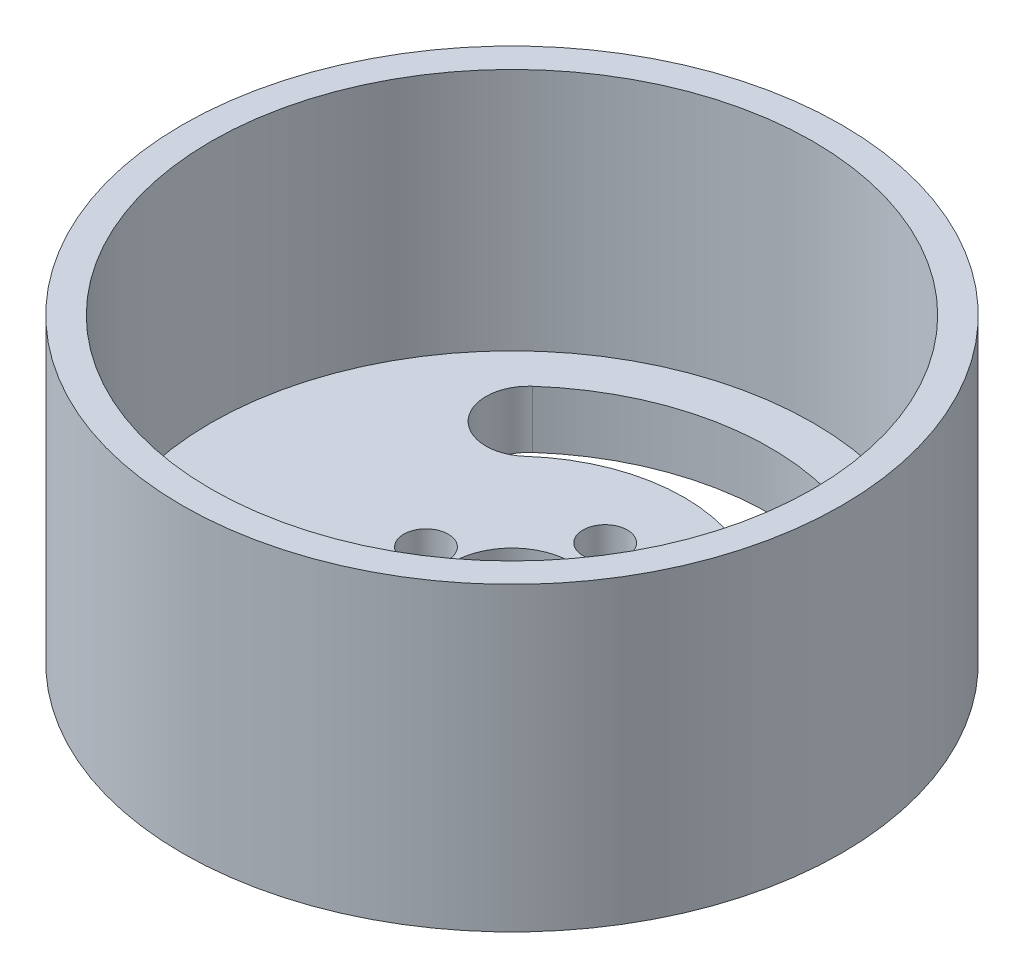
from build123d import *

# Parameters (mm, degrees)
SKETCH_1_R      = 23
SKETCH_1_R_2    = 21
EXTRUDE_1_DEPTH = 21
SKETCH_2_R      = 23
SKETCH_2_R_2    = 4.15
SKETCH_2_R_3    = 1.55
EXTRUDE_2_DEPTH = 4


with BuildPart() as part:
    # 草图1 → 凸台-拉伸1 (new body)
    with BuildSketch(Plane(origin=(0, 0, 0), x_dir=(1, 0, 0), z_dir=(0, 1, 0))):
        Circle(SKETCH_1_R)
        Circle(SKETCH_1_R_2, mode=Mode.SUBTRACT)
    extrude(amount=EXTRUDE_1_DEPTH)

    # 草图2 → 凸台-拉伸2 (add)
    with BuildSketch(Plane.XZ):
        Circle(SKETCH_2_R)
        Circle(SKETCH_2_R_2, mode=Mode.SUBTRACT)
        with Locations((6, 0)):
            Circle(SKETCH_2_R_3, mode=Mode.SUBTRACT)
        with Locations((-6, 0)):
            Circle(SKETCH_2_R_3, mode=Mode.SUBTRACT)
        with Locations((0, 6.5)):
            Circle(SKETCH_2_R_3, mode=Mode.SUBTRACT)
        with Locations((0, -6.5)):
            Circle(SKETCH_2_R_3, mode=Mode.SUBTRACT)
        with BuildLine():
            ThreePointArc((12, 13.416407865), (0, 18), (-12, 13.416407865))
            ThreePointArc((-12, 13.416407865), (-12.236067977, 9.180339887), (-8, 8.94427191))
            ThreePointArc((-8, 8.94427191), (0, 12), (8, 8.94427191))
            ThreePointArc((8, 8.94427191), (12.236067977, 9.180339887), (12, 13.416407865))
        make_face(mode=Mode.SUBTRACT)
        with BuildLine():
            ThreePointArc((12, -13.416407865), (0, -18), (-12, -13.416407865))
            ThreePointArc((-12, -13.416407865), (-12.236067977, -9.180339887), (-8, -8.94427191))
            ThreePointArc((-8, -8.94427191), (0, -12), (8, -8.94427191))
            ThreePointArc((8, -8.94427191), (12.236067977, -9.180339887), (12, -13.416407865))
        make_face(mode=Mode.SUBTRACT)
    extrude(amount=-EXTRUDE_2_DEPTH)


solid = part.part
